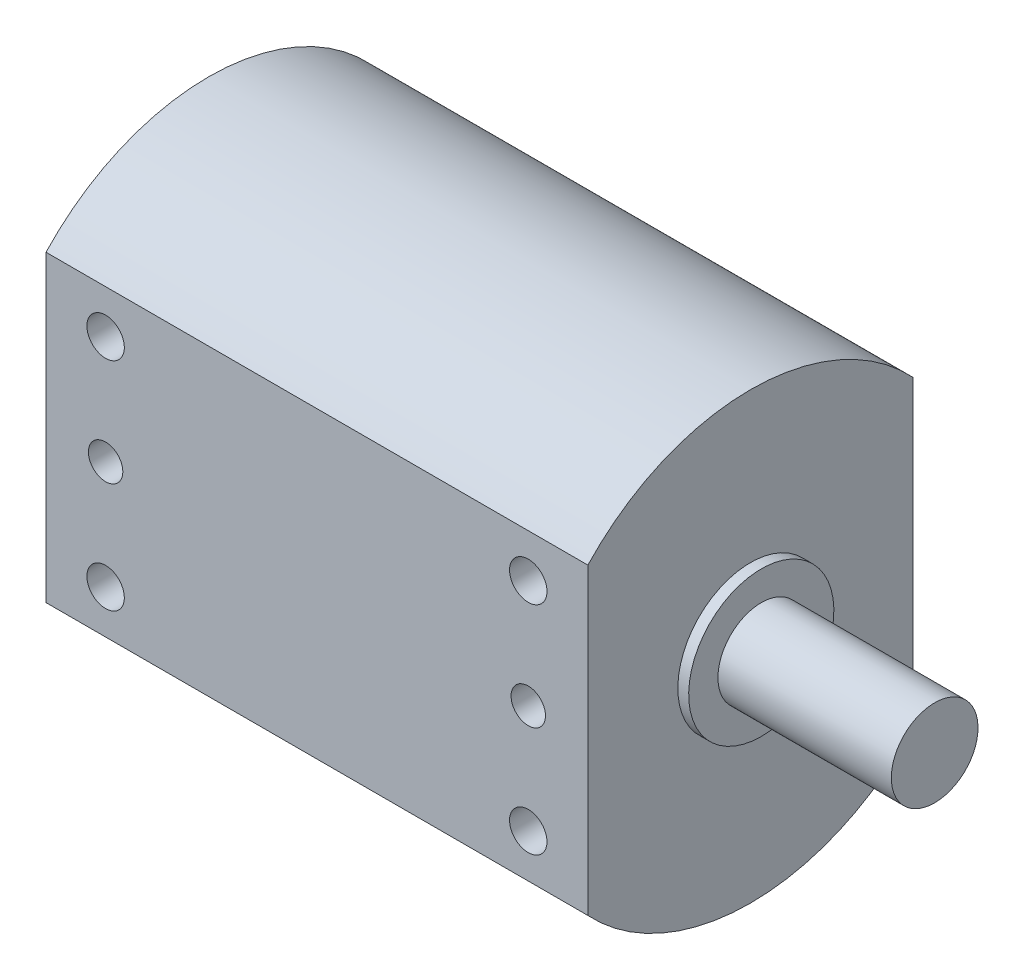
from build123d import *

# Parameters (mm, degrees)
CUT_EXTRUDE1_DEPTH                  = 74.013697345
CUT_EXTRUDE1_DEPTH_BACK             = 74.013697345
SKETCH3_OUTSIDE_W                   = 62.16
SKETCH3_OUTSIDE_H                   = 62.16
SKETCH3_OUTSIDE_W_2                 = 30
SKETCH3_OUTSIDE_H_2                 = 41.036569058
F_8_32_TAPPED_HOLE1_AT_2_COUNT      = 2
F_8_32_TAPPED_HOLE1_AT_2_PITCH      = 43.829214002
F_8_32_TAPPED_HOLE1_AT_3_COUNT      = 2
F_8_32_TAPPED_HOLE1_AT_3_PITCH      = 20
F_8_32_TAPPED_HOLE1_AT_4_COUNT      = 2
F_8_32_TAPPED_HOLE1_AT_4_PITCH      = 39
F_1_8_0_1250_DOWEL_HOLE1_AT_2_COUNT = 2
F_1_8_0_1250_DOWEL_HOLE1_AT_2_PITCH = 39
F_8_32_TAPPED_HOLE2_D               = 3.4544
F_8_32_TAPPED_HOLE2_DEPTH           = 10.71
F_8_32_TAPPED_HOLE2_TIP             = 1.037806461


with BuildPart() as part:
    # Sketch2 → Revolve1 (revolve)
    with BuildSketch(Plane.XY):
        Polygon((-34, 0), (42, 0), (42, 4), (26, 4), (26, 6.7), (25, 6.7), (25, 20.518284529), (-25, 20.518284529), (-25, 6.7), (-27.5, 6.7), (-27.5, 4), (-34, 4), align=None)
    revolve(axis=Axis((-34, 0, 0), (1, 0, 0)))

    # Sketch3 outside → Cut-Extrude1 (cut, two sides: drawn at the far end of the back side and taken through both)
    with BuildSketch(Plane.ZY.offset(25).offset(-CUT_EXTRUDE1_DEPTH_BACK)):
        Rectangle(SKETCH3_OUTSIDE_W, SKETCH3_OUTSIDE_H)
        Rectangle(SKETCH3_OUTSIDE_W_2, SKETCH3_OUTSIDE_H_2, mode=Mode.SUBTRACT)
    extrude(amount=CUT_EXTRUDE1_DEPTH + CUT_EXTRUDE1_DEPTH_BACK, mode=Mode.SUBTRACT)

    # Sketch5 → #8-32 Tapped Hole1 (revolve, cut)
    with BuildSketch(Plane(origin=(19.5, 10, -15), x_dir=(0, 1, 0), z_dir=(1, 0, 0))):
        Polygon((0, 0), (0, 11.747806461), (1.7272, 10.71), (1.7272, 0), align=None)
    f_8_32_tapped_hole1 = revolve(axis=Axis((19.5, 10, -21.35), (0, 0, 1)), mode=Mode.SUBTRACT)

    # #8-32 Tapped Hole1 at 2: #8-32 Tapped Hole1 ×2
    with Locations(*[Vector(-0.889817462812737, -0.4563166475962754, 0) * (i * F_8_32_TAPPED_HOLE1_AT_2_PITCH) for i in range(1, F_8_32_TAPPED_HOLE1_AT_2_COUNT)]):
        add(f_8_32_tapped_hole1, mode=Mode.SUBTRACT)

    # #8-32 Tapped Hole1 at 3: #8-32 Tapped Hole1 ×2
    with Locations(*[(0, -i * F_8_32_TAPPED_HOLE1_AT_3_PITCH, 0) for i in range(1, F_8_32_TAPPED_HOLE1_AT_3_COUNT)]):
        add(f_8_32_tapped_hole1, mode=Mode.SUBTRACT)

    # #8-32 Tapped Hole1 at 4: #8-32 Tapped Hole1 ×2
    with Locations(*[(-i * F_8_32_TAPPED_HOLE1_AT_4_PITCH, 0, 0) for i in range(1, F_8_32_TAPPED_HOLE1_AT_4_COUNT)]):
        add(f_8_32_tapped_hole1, mode=Mode.SUBTRACT)

    # Sketch7 → 1/8 (0.1250) Dowel Hole1 (revolve, cut)
    with BuildSketch(Plane(origin=(19.5, 0, -15), x_dir=(0, 1, 0), z_dir=(1, 0, 0))):
        Polygon((0, 0), (0, 6.953866233), (1.5875, 6), (1.5875, 0), align=None)
    f_1_8_0_1250_dowel_hole1 = revolve(axis=Axis((19.5, 0, -21.35), (0, 0, 1)), mode=Mode.SUBTRACT)

    # 1/8 (0.1250) Dowel Hole1 at 2: 1/8 (0.1250) Dowel Hole1 ×2
    with Locations(*[(-i * F_1_8_0_1250_DOWEL_HOLE1_AT_2_PITCH, 0, 0) for i in range(1, F_1_8_0_1250_DOWEL_HOLE1_AT_2_COUNT)]):
        add(f_1_8_0_1250_dowel_hole1, mode=Mode.SUBTRACT)

    # Mirror1: #8-32 Tapped Hole1, 1/8 (0.1250) Dowel Hole1 across plane
    add(f_8_32_tapped_hole1.mirror(Plane.XY), mode=Mode.SUBTRACT)
    add(f_1_8_0_1250_dowel_hole1.mirror(Plane.XY), mode=Mode.SUBTRACT)

    # Mirror1 copy 1 sketch → Mirror1 copy 1 (revolve, cut)
    with BuildSketch(Plane(origin=(-19.5, -10, 15), x_dir=(0, 1, 0), z_dir=(1, 0, 0))):
        Polygon((0, 0), (0, -11.747806461), (1.7272, -10.71), (1.7272, 0), align=None)
    revolve(axis=Axis((-19.5, -10, 21.35), (0, 0, 1)), mode=Mode.SUBTRACT)

    # Mirror1 copy 2 sketch → Mirror1 copy 2 (revolve, cut)
    with BuildSketch(Plane(origin=(19.5, -10, 15), x_dir=(0, 1, 0), z_dir=(1, 0, 0))):
        Polygon((0, 0), (0, -11.747806461), (1.7272, -10.71), (1.7272, 0), align=None)
    revolve(axis=Axis((19.5, -10, 21.35), (0, 0, 1)), mode=Mode.SUBTRACT)

    # Mirror1 copy 3 sketch → Mirror1 copy 3 (revolve, cut)
    with BuildSketch(Plane(origin=(-19.5, 10, 15), x_dir=(0, 1, 0), z_dir=(1, 0, 0))):
        Polygon((0, 0), (0, -11.747806461), (1.7272, -10.71), (1.7272, 0), align=None)
    revolve(axis=Axis((-19.5, 10, 21.35), (0, 0, 1)), mode=Mode.SUBTRACT)

    # Mirror1 copy 4 sketch → Mirror1 copy 4 (revolve, cut)
    with BuildSketch(Plane(origin=(-19.5, 0, 15), x_dir=(0, 1, 0), z_dir=(1, 0, 0))):
        Polygon((0, 0), (0, -6.953866233), (1.5875, -6), (1.5875, 0), align=None)
    revolve(axis=Axis((-19.5, 0, 21.35), (0, 0, 1)), mode=Mode.SUBTRACT)

    # #8-32 Tapped Hole2
    with Locations(Plane.ZY.offset(34)):
        with Locations((0, 0)):
            Hole(F_8_32_TAPPED_HOLE2_D / 2, depth=F_8_32_TAPPED_HOLE2_DEPTH)
            with Locations((0, 0, -(F_8_32_TAPPED_HOLE2_DEPTH + F_8_32_TAPPED_HOLE2_TIP / 2))):  # 118° drill point
                Cone(0, F_8_32_TAPPED_HOLE2_D / 2, F_8_32_TAPPED_HOLE2_TIP, mode=Mode.SUBTRACT)


solid = part.part
